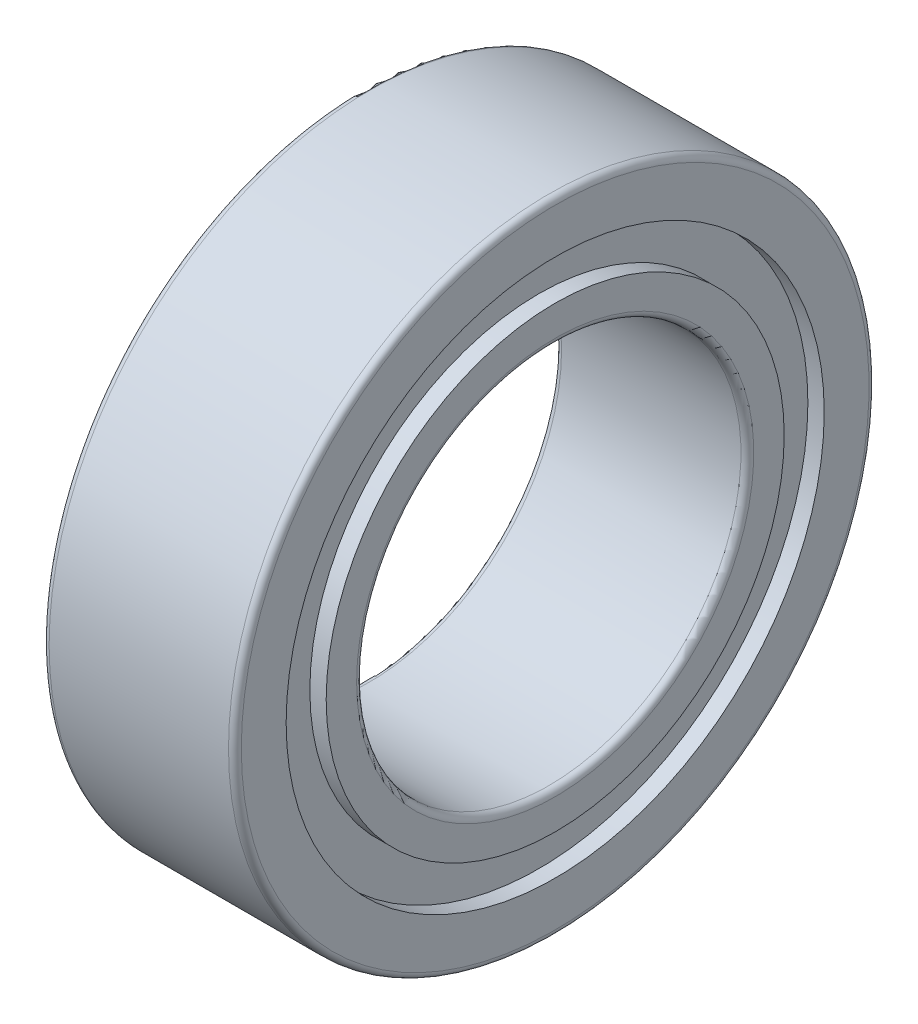
from build123d import *

# Parameters (mm, degrees)
FILLET1_R = 0.1
FILLET2_R = 0.1


with BuildPart() as part:
    # Sketch1 → Revolve1 (revolve)
    with BuildSketch(Plane.XY):
        Polygon((0, 3), (3, 3), (3, 3.575), (2.745, 3.575), (2.745, 4.2), (3, 4.2), (3, 5), (0, 5), (0, 4.2), (0.255, 4.2), (0.255, 3.575), (0, 3.575), align=None)
    revolve(axis=Axis((0, 0, 0), (1, 0, 0)))

    # Fillet1
    fillet1_edges = [part.edges().sort_by_distance(p)[0] for p in [
        (3, -5, 0),
        (0, -5, 0),
    ]]
    fillet(fillet1_edges, radius=FILLET1_R)

    # Fillet2
    fillet2_edges = [part.edges().sort_by_distance(p)[0] for p in [
        (3, -3, 0),
        (0, -3, 0),
    ]]
    fillet(fillet2_edges, radius=FILLET2_R)


solid = part.part
